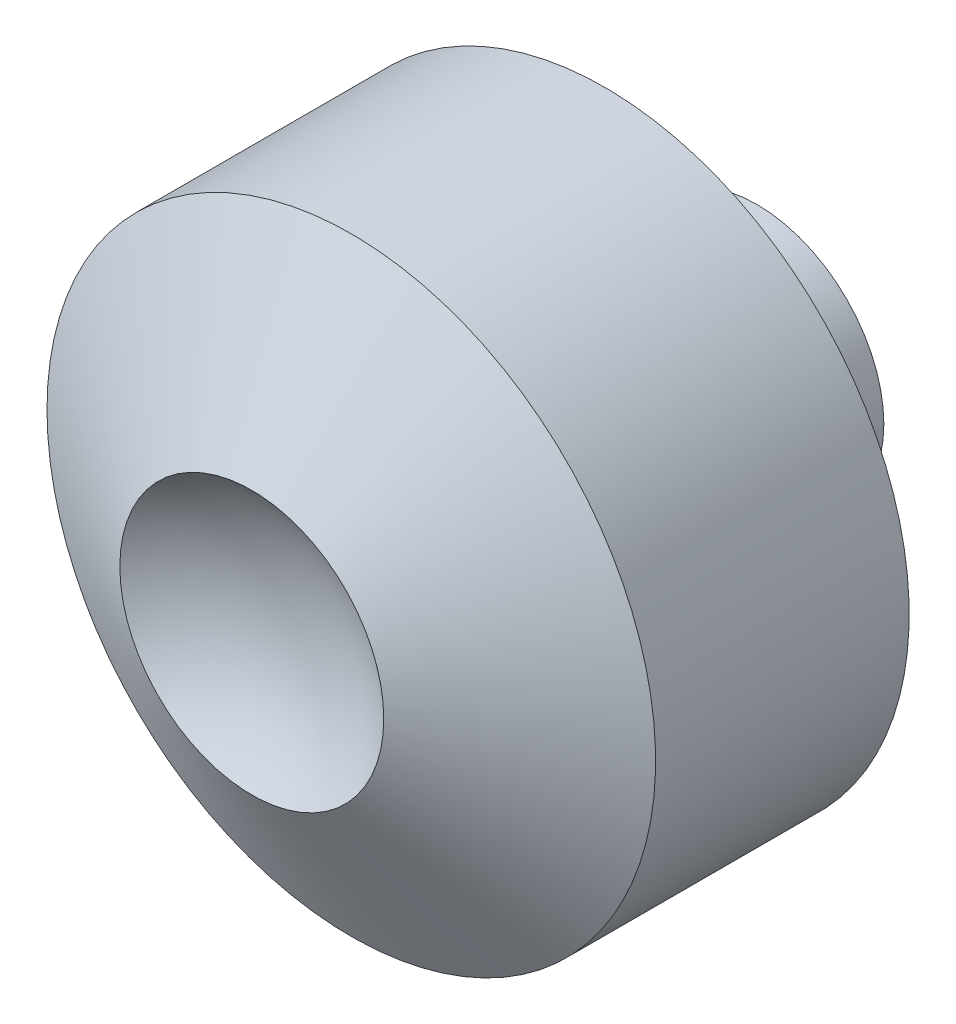
from build123d import *
from build123d.topology import SkipClean

# Parameters (mm, degrees)
SKETCH2_R           = 6
BOSS_EXTRUDE1_DEPTH = 2
CHAMFER1_SIZE       = 2
CHAMFER1_SIZE_2     = 3.464101615
SKETCH4_R           = 6
BOSS_EXTRUDE2_DEPTH = 5
SKETCH6_R           = 2.5
BOSS_EXTRUDE3_DEPTH = 3


with BuildPart() as part:
    # Sketch2 → Boss-Extrude1 (new body)
    with BuildSketch(Plane.XY):
        Circle(SKETCH2_R)
    extrude(amount=BOSS_EXTRUDE1_DEPTH)

    # Sketch3 one side → Cut-Revolve1 (revolve, cut)
    with SkipClean():  # the faces are left unmerged after this step: merging them gives an invalid solid
        with BuildSketch(Plane(origin=(0, 0, 0), x_dir=(0, 0, -1), z_dir=(1, 0, 0))):
            with BuildLine():
                ThreePointArc((-5, -4), (-2.171572875, -2.828427125), (-1, 0))
                ThreePointArc((-1, 0), (-2.171572875, 2.828427125), (-5, 4))
                Line((-5, 4), (-5, -4))
            make_face()
        revolve(axis=Axis((0, 4, 5), (0, -1, 0)), mode=Mode.SUBTRACT)

    # Chamfer1
    # the kernel refuses this chamfer: 3.464101615, 2 mm, written as the material it takes off along each edge
    with BuildSketch(Plane(origin=(0, 0, 2), x_dir=(1, 0, 0), z_dir=(0, -1, 0))) as chamfer1_piece_1:
        Polygon((6, -CHAMFER1_SIZE), (6 - CHAMFER1_SIZE_2, 0), (6, 0), align=None)
    revolve(axis=Axis((0, 0, 2), (0, 0, 1)), mode=Mode.SUBTRACT)

    # Sketch4 → Boss-Extrude2 (add)
    with BuildSketch(Plane(origin=(0, 0, 0), x_dir=(-1, 0, 0), z_dir=(0, 0, -1))):
        Circle(SKETCH4_R)
    extrude(amount=BOSS_EXTRUDE2_DEPTH)

    # Sketch6 → Boss-Extrude3 (add)
    with BuildSketch(Plane(origin=(0, 0, -5), x_dir=(-1, 0, 0), z_dir=(0, 0, -1))):
        Circle(SKETCH6_R)
    extrude(amount=BOSS_EXTRUDE3_DEPTH)


solid = part.part
